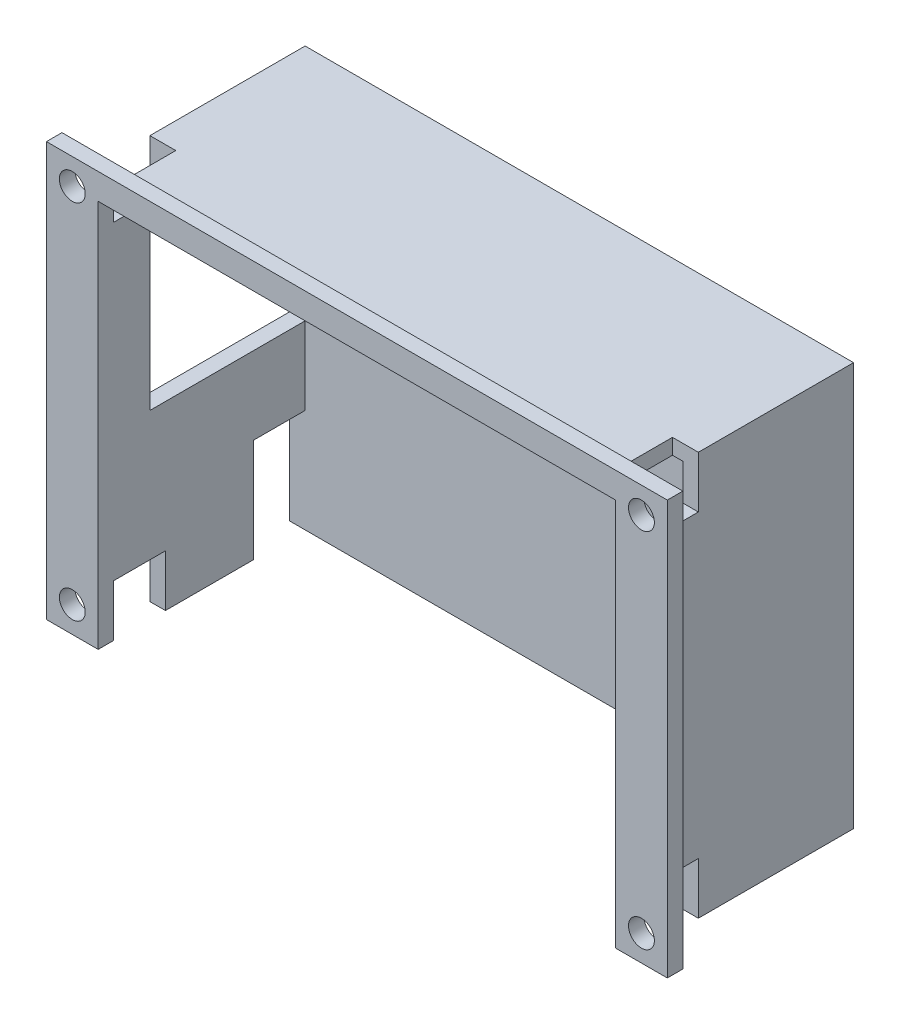
from build123d import *

# Parameters (mm, degrees)
SKETCH2_W           = 60
SKETCH2_H           = 40
SKETCH2_R           = 1.25
BOSS_EXTRUDE3_DEPTH = 1.5
SKETCH3_W           = 53
SKETCH3_H           = 39
BOSS_EXTRUDE4_DEPTH = 20
SKETCH7_W           = 50
SKETCH7_H           = 37.5
CUT_EXTRUDE4_DEPTH  = 20
SKETCH8_W           = 5
SKETCH8_H           = 5
CUT_EXTRUDE5_DEPTH  = 2.5
SKETCH11_W          = 5
SKETCH11_H          = 5
CUT_EXTRUDE8_DEPTH  = 2.5
SKETCH17_W          = 15
SKETCH17_H          = 17.5
SKETCH17_W_2        = 5
SKETCH17_H_2        = 10
CUT_EXTRUDE13_DEPTH = 2.5


with BuildPart() as part:
    # Sketch2 → Boss-Extrude3 (new body)
    with BuildSketch(Plane.XY):
        with Locations((45.305986755, 42.83362131)):
            Rectangle(SKETCH2_W, SKETCH2_H)
        with Locations((17.805986755, 60.33362131)):
            Circle(SKETCH2_R, mode=Mode.SUBTRACT)
        with Locations((17.805986755, 25.33362131)):
            Circle(SKETCH2_R, mode=Mode.SUBTRACT)
        with Locations((72.805986755, 25.33362131)):
            Circle(SKETCH2_R, mode=Mode.SUBTRACT)
        with Locations((72.805986755, 60.33362131)):
            Circle(SKETCH2_R, mode=Mode.SUBTRACT)
    extrude(amount=BOSS_EXTRUDE3_DEPTH)

    # Sketch3 → Boss-Extrude4 (add)
    with BuildSketch(Plane(origin=(0, 0, 0), x_dir=(-1, 0, 0), z_dir=(0, 0, -1))):
        with Locations((-45.305986755, 42.33362131)):
            Rectangle(SKETCH3_W, SKETCH3_H)
    extrude(amount=BOSS_EXTRUDE4_DEPTH)

    # Sketch7 → Cut-Extrude4 (cut)
    with BuildSketch(Plane.XY.offset(1.5)):
        with Locations((45.305986755, 41.58362131)):
            Rectangle(SKETCH7_W, SKETCH7_H)
    extrude(amount=-CUT_EXTRUDE4_DEPTH, mode=Mode.SUBTRACT)

    # Sketch8 → Cut-Extrude5 (cut)
    with BuildSketch(Plane(origin=(71.805986755, 0, 0), x_dir=(0, 0, -1), z_dir=(1, 0, 0))):
        with Locations((2.5, 59.33362131)):
            Rectangle(SKETCH8_W, SKETCH8_H)
        with Locations((2.5, 25.33362131)):
            Rectangle(SKETCH8_W, SKETCH8_H)
    extrude(amount=-CUT_EXTRUDE5_DEPTH, mode=Mode.SUBTRACT)

    # Sketch11 → Cut-Extrude8 (cut)
    with BuildSketch(Plane.ZY.offset(-18.805986755)):
        with Locations((-2.5, 60.33362131)):
            Rectangle(SKETCH11_W, SKETCH11_H)
        with Locations((-2.5, 25.33362131)):
            Rectangle(SKETCH11_W, SKETCH11_H)
    extrude(amount=-CUT_EXTRUDE8_DEPTH, mode=Mode.SUBTRACT)

    # Sketch17 → Cut-Extrude13 (cut)
    with BuildSketch(Plane.ZY.offset(-18.805986755)):
        with Locations((-11, 49.08362131)):
            Rectangle(SKETCH17_W, SKETCH17_H)
        with Locations((-16, 27.83362131)):
            Rectangle(SKETCH17_W_2, SKETCH17_H_2)
    extrude(amount=-CUT_EXTRUDE13_DEPTH, mode=Mode.SUBTRACT)


solid = part.part
